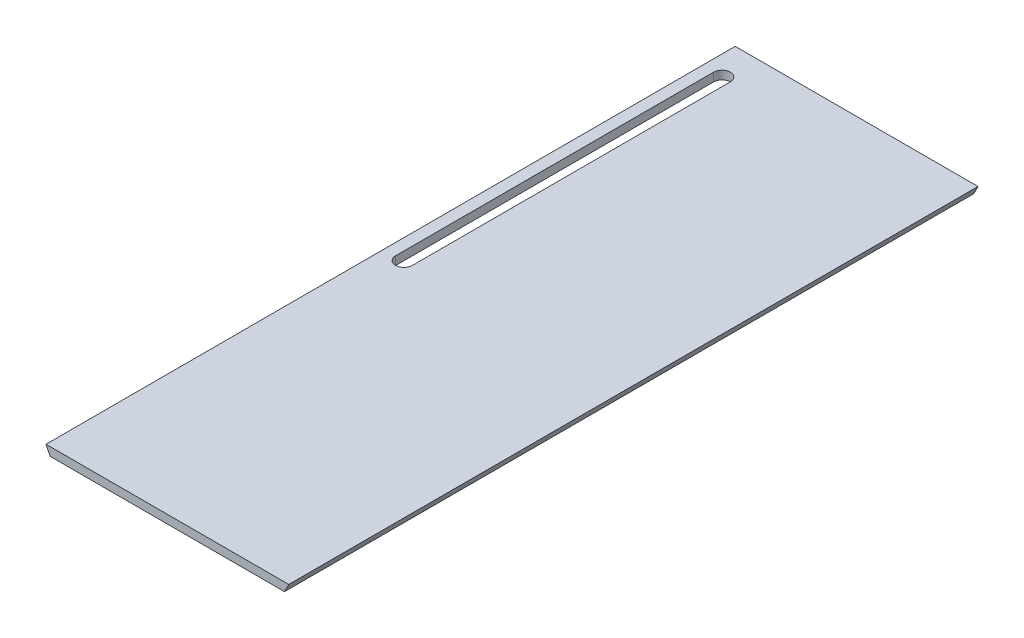
from build123d import *

# Parameters (mm, degrees)
BOSS_EXTRUDE1_DEPTH = 261.62
CUT_EXTRUDE1_DEPTH  = 266.665663227


with BuildPart() as part:
    # Sketch2 → Boss-Extrude1 (new body)
    with BuildSketch(Plane.XY):
        with BuildLine():
            Line((-44.45, -24.593444248), (44.45, -24.593444248))
            ThreePointArc((44.45, -24.593444248), (45.291168316, -23.007609015), (46.075781684, -21.393044248))
            Line((46.075781684, -21.393044248), (-46.075781684, -21.393044248))
            ThreePointArc((-46.075781684, -21.393044248), (-45.291168316, -23.007609015), (-44.45, -24.593444248))
        make_face()
    extrude(amount=BOSS_EXTRUDE1_DEPTH)

    # Sketch3 → Cut-Extrude1 (cut, through all)
    with BuildSketch(Plane(origin=(0, -21.393044248, 0), x_dir=(-1, 0, 0), z_dir=(0, 1, 0))):
        with BuildLine():
            Line((35.32929924, 12.595958552), (35.32929924, 133.302587666))
            ThreePointArc((35.32929924, 133.302587666), (38.50429924, 136.477587666), (41.67929924, 133.302587666))
            Line((41.67929924, 133.302587666), (41.67929924, 12.595958552))
            ThreePointArc((41.67929924, 12.595958552), (38.50429924, 9.420958552), (35.32929924, 12.595958552))
        make_face()
    extrude(amount=-CUT_EXTRUDE1_DEPTH, mode=Mode.SUBTRACT)


solid = part.part
